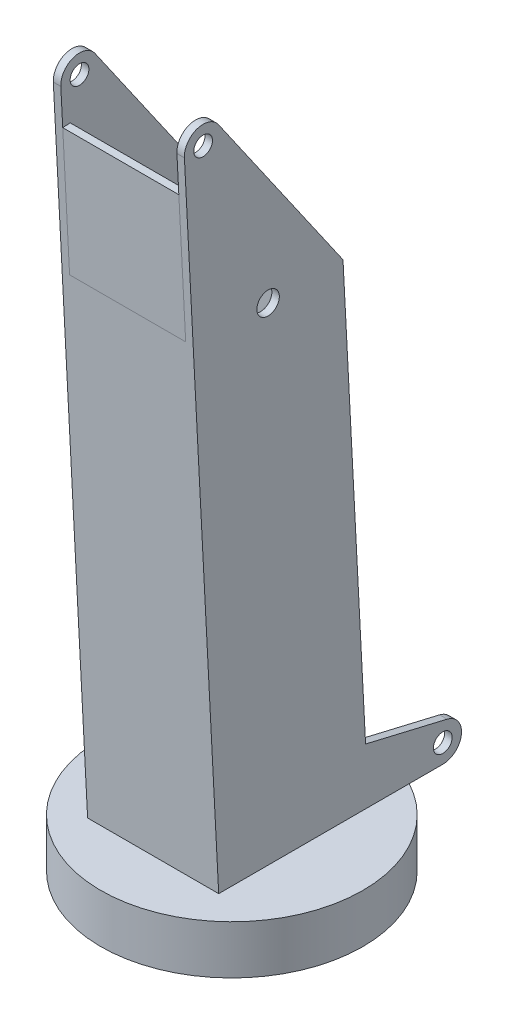
from build123d import *

# Parameters (mm, degrees)
BOSS_EXTRUDE1_DEPTH = 20
BOSS_EXTRUDE2_DEPTH = 350
SHELL1_START        = -330
SHELL1_DEPTH        = 310
SKETCH3_R           = 25
CUT_EXTRUDE1_DEPTH  = 20
SKETCH4_W           = 310
SKETCH4_H           = 350
BOSS_EXTRUDE6_DEPTH = 20
SKETCH5_R           = 25
BOSS_EXTRUDE8_DEPTH = 20
SKETCH6_R           = 30
CUT_EXTRUDE2_DEPTH  = 1526.0740711
SKETCH8_R           = 350
BOSS_EXTRUDE9_DEPTH = 130
SKETCH9_R           = 300
CUT_EXTRUDE3_DEPTH  = 100


# Read off the part's stored shape, not the designer's step: Shell1
with BuildPart() as part:
    # Sketch1 → Boss-Extrude1 (new body)
    with BuildSketch(Plane(origin=(0, 0, 0), x_dir=(0, 0, -1), z_dir=(1, 0, 0))):
        with BuildLine():
            Line((0, 0), (-23.446360115, 447.383202188))
            ThreePointArc((-23.446360115, 447.383202188), (10.293696853, 497.305791674), (67.54794645, 478.527951321))
            Line((67.54794645, 478.527951321), (400, 0))
            Line((400, 0), (0, 0))
        make_face()
    boss_extrude1 = extrude(amount=-BOSS_EXTRUDE1_DEPTH)

    # Sketch2 → Boss-Extrude2 (add)
    with BuildSketch(Plane(origin=(0, 0, 0), x_dir=(0, 0, -1), z_dir=(1, 0, 0))):
        Polygon((0, 0), (400, 0), (468.130113068, -1300), (68.130113068, -1300), align=None)
    extrude(amount=-BOSS_EXTRUDE2_DEPTH)

    # Shell1 outline → Shell1 (cut)
    with BuildSketch(Plane.YZ.offset(SHELL1_START)):
        Polygon((0, -375.647075367), (0, -20.02744692), (-1280, -87.109404402), (-1280, -447.054510562), (-6.734029496, -380.325468612), align=None)
    shell1 = extrude(amount=SHELL1_DEPTH, mode=Mode.SUBTRACT)

    # Sketch3 → Cut-Extrude1 (cut)
    with BuildSketch(Plane(origin=(0, 0, 0), x_dir=(0, 0, -1), z_dir=(1, 0, 0))):
        with Locations((26.485116623, 450)):
            Circle(SKETCH3_R)
    cut_extrude1 = extrude(amount=-CUT_EXTRUDE1_DEPTH, mode=Mode.SUBTRACT)

    # Mirror1: Boss-Extrude1, Shell1, Cut-Extrude1 across plane
    add(boss_extrude1.mirror(Plane(origin=(-175, 0, 0), x_dir=(0, 0, 1), z_dir=(1, 0, 0))))
    add(shell1.mirror(Plane(origin=(-175, 0, 0), x_dir=(0, 0, 1), z_dir=(1, 0, 0))), mode=Mode.SUBTRACT)
    add(cut_extrude1.mirror(Plane(origin=(-175, 0, 0), x_dir=(0, 0, 1), z_dir=(1, 0, 0))), mode=Mode.SUBTRACT)

    # Sketch5 → Boss-Extrude8 (add)
    with BuildSketch(Plane(origin=(0, 0, 0), x_dir=(0, 0, -1), z_dir=(1, 0, 0))):
        with BuildLine():
            Line((468.130113068, -1300), (666.485116623, -1300))
            ThreePointArc((666.485116623, -1300), (716.150299283, -1255.77664533), (677.961042442, -1201.334785251))
            Line((677.961042442, -1201.334785251), (460.268946175, -1150))
            Line((460.268946175, -1150), (468.130113068, -1300))
        make_face()
        with Locations((666.485116623, -1250)):
            Circle(SKETCH5_R, mode=Mode.SUBTRACT)
    boss_extrude8 = extrude(amount=-BOSS_EXTRUDE8_DEPTH)

    # Mirror2: Boss-Extrude8 across plane
    add(boss_extrude8.mirror(Plane(origin=(-175, 0, 0), x_dir=(0, 0, 1), z_dir=(1, 0, 0))))

    # Sketch6 → Cut-Extrude2 (cut, through all)
    with BuildSketch(Plane(origin=(0, 0, 0), x_dir=(0, 0, -1), z_dir=(1, 0, 0))):
        with Locations((200, 0)):
            Circle(SKETCH6_R)
    extrude(amount=-CUT_EXTRUDE2_DEPTH, mode=Mode.SUBTRACT)

    # Sketch8 → Boss-Extrude9 (add)
    with BuildSketch(Plane(origin=(0, -1300, 0), x_dir=(-1, 0, 0), z_dir=(0, -1, 0))):
        with Locations(Location((165, 268.130113068, 0), (0, 0, 58.091017265))):
            Circle(SKETCH8_R)
    extrude(amount=BOSS_EXTRUDE9_DEPTH)

    # Sketch9 → Cut-Extrude3 (cut)
    with BuildSketch(Plane.XZ.offset(1430)):
        with Locations(Location((-165, -268.130113068, 0), (0, 0, 270))):
            Circle(SKETCH9_R)
    extrude(amount=-CUT_EXTRUDE3_DEPTH, mode=Mode.SUBTRACT)


with BuildPart() as body_2:
    # Sketch4 → Boss-Extrude6 (new body)
    with BuildSketch(Plane(origin=(0, 0, 0), x_dir=(1, 0, 0), z_dir=(0, -0.05233595624294052, 0.9986295347545742))):
        with Locations((-175, 175)):
            Rectangle(SKETCH4_W, SKETCH4_H)
    extrude(amount=-BOSS_EXTRUDE6_DEPTH)


solid = Compound([part.part, body_2.part])
